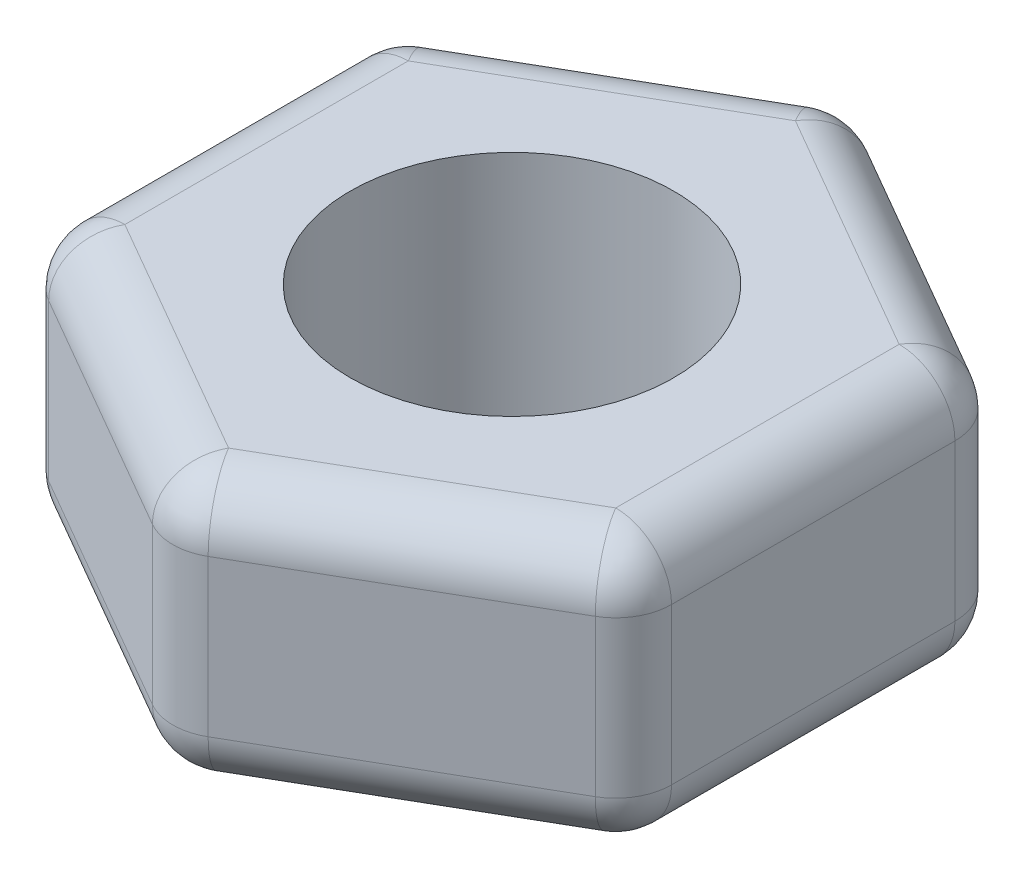
from build123d import *

# Parameters (mm, degrees)
SKETCH1_R           = 1.45
BOSS_EXTRUDE1_DEPTH = 2.4
FILLET1_R           = 0.5


with BuildPart() as part:
    # Sketch1 → Boss-Extrude1 (new body)
    with BuildSketch(Plane(origin=(0, 0, 0), x_dir=(1, 0, 0), z_dir=(0, 1, 0))):
        Polygon((0, 3.117691454), (-2.7, 1.558845727), (-2.7, -1.558845727), (0, -3.117691454), (2.7, -1.558845727), (2.7, 1.558845727), align=None)
        Circle(SKETCH1_R, mode=Mode.SUBTRACT)
    extrude(amount=BOSS_EXTRUDE1_DEPTH)

    # Fillet1
    fillet1_edges = [part.edges().sort_by_distance(p)[0] for p in [
        (-1.35, 0, -2.33826859),
        (-2.7, 0, 0),
        (-1.35, 0, 2.33826859),
        (1.35, 0, 2.33826859),
        (1.35, 0, -2.33826859),
        (2.7, 0, 0),
        (2.7, 2.4, 0),
        (-1.35, 2.4, 2.33826859),
        (-2.7, 2.4, 0),
        (-1.35, 2.4, -2.33826859),
        (1.35, 2.4, -2.33826859),
        (1.35, 2.4, 2.33826859),
        (2.7, 1.2, -1.558845727),
        (-2.7, 1.2, 1.558845727),
        (-2.7, 1.2, -1.558845727),
        (0, 1.2, -3.117691454),
        (2.7, 1.2, 1.558845727),
        (0, 1.2, 3.117691454),
    ]]
    fillet(fillet1_edges, radius=FILLET1_R)


solid = part.part
